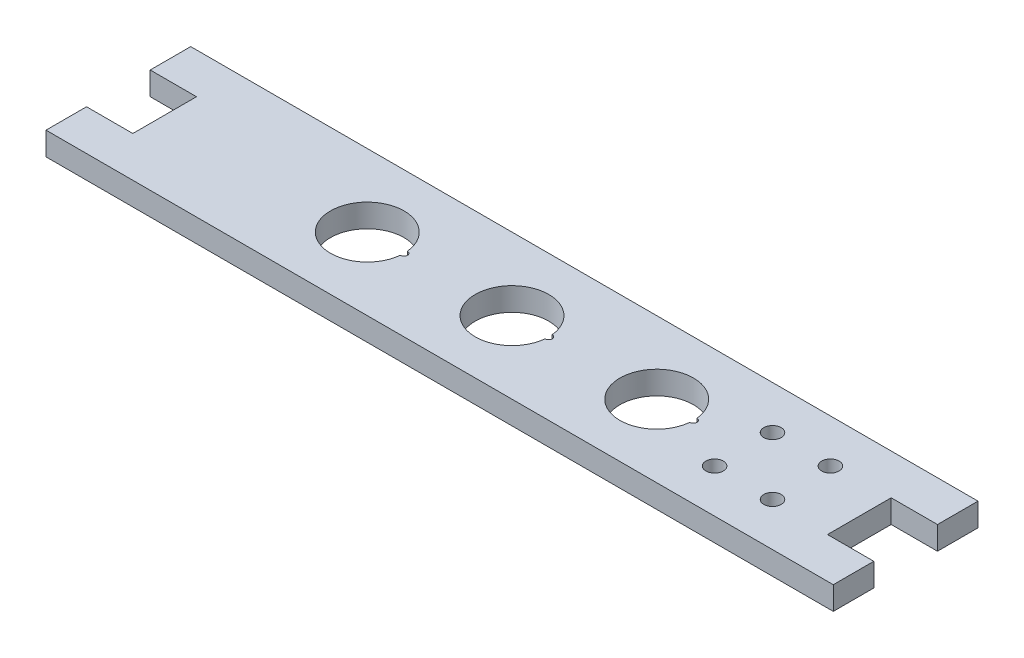
from build123d import *

# Parameters (mm, degrees)
SKETCH1_W           = 120
SKETCH1_H           = 25
SKETCH1_R           = 1.5
BOSS_EXTRUDE1_DEPTH = 4
SKETCH2_W           = 7
SKETCH2_H           = 4
BOSS_EXTRUDE2_DEPTH = 8


with BuildPart() as part:
    # Sketch1 → Boss-Extrude1 (new body)
    with BuildSketch(Plane(origin=(0, 0, 0), x_dir=(1, 0, 0), z_dir=(0, 1, 0))):
        Rectangle(SKETCH1_W, SKETCH1_H)
        with Locations((40, 5)):
            Circle(SKETCH1_R, mode=Mode.SUBTRACT)
        with Locations((40, -5)):
            Circle(SKETCH1_R, mode=Mode.SUBTRACT)
        with Locations((50, 5)):
            Circle(SKETCH1_R, mode=Mode.SUBTRACT)
        with Locations((50, -5)):
            Circle(SKETCH1_R, mode=Mode.SUBTRACT)
        with BuildLine():
            ThreePointArc((31.321653543, 0.599330025), (31.95, 0), (31.321653543, -0.599330025))
            ThreePointArc((31.321653543, -0.599330025), (18.65, 0), (31.321653543, 0.599330025))
        make_face(mode=Mode.SUBTRACT)
        with BuildLine():
            ThreePointArc((6.321653543, 0.599330025), (6.95, 0), (6.321653543, -0.599330025))
            ThreePointArc((6.321653543, -0.599330025), (-6.35, 0), (6.321653543, 0.599330025))
        make_face(mode=Mode.SUBTRACT)
        with BuildLine():
            ThreePointArc((-18.678346457, 0.599330025), (-18.05, 0), (-18.678346457, -0.599330025))
            ThreePointArc((-18.678346457, -0.599330025), (-31.35, 0), (-18.678346457, 0.599330025))
        make_face(mode=Mode.SUBTRACT)
    extrude(amount=BOSS_EXTRUDE1_DEPTH)

    # Sketch2 → Boss-Extrude2 (add)
    with BuildSketch(Plane.ZY.offset(60)):
        with Locations((-9, 2)):
            Rectangle(SKETCH2_W, SKETCH2_H)
        with Locations((9, 2)):
            Rectangle(SKETCH2_W, SKETCH2_H)
    boss_extrude2 = extrude(amount=BOSS_EXTRUDE2_DEPTH)

    # Mirror1: Boss-Extrude2 across plane
    add(boss_extrude2.mirror(Plane.ZY))


solid = part.part
